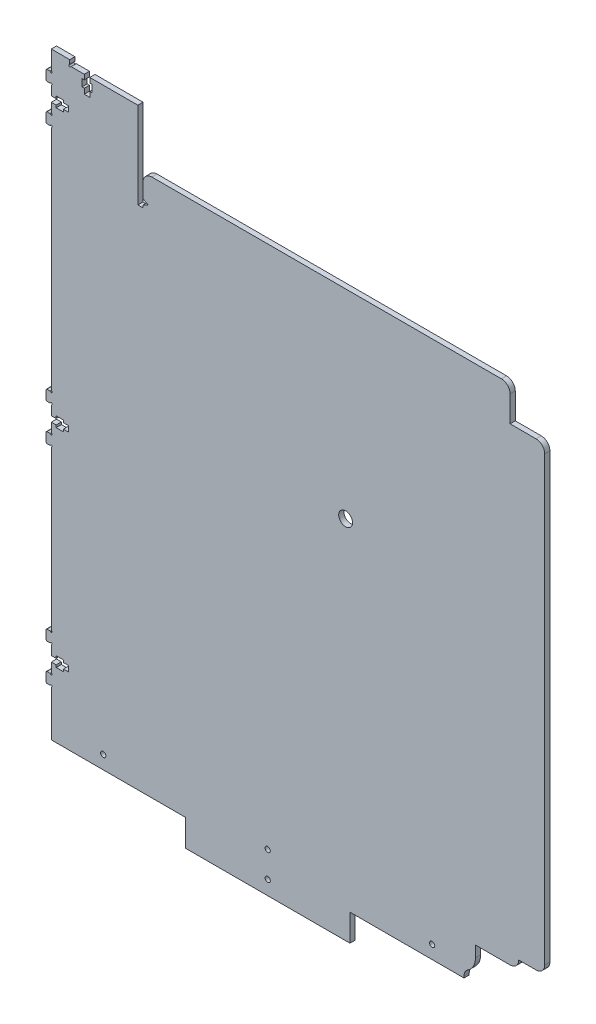
from build123d import *

# Parameters (mm, degrees)
SKETCH2_R           = 1.5
SKETCH2_R_2         = 4
BOSS_EXTRUDE1_DEPTH = 3


with BuildPart() as part:
    # Sketch2 → Boss-Extrude1 (new body)
    with BuildSketch(Plane.XY):
        with BuildLine():
            Line((66.614036598, 872.123994363), (69.614036598, 872.123994363))
            Line((69.614036598, 872.123994363), (69.614036598, 873.621424207))
            Line((69.614036598, 873.621424207), (72.614036598, 875.121424207))
            Line((72.614036598, 875.121424207), (69.614036598, 876.621424207))
            Line((69.614036598, 876.621424207), (69.614036598, 885.121424207))
            ThreePointArc((69.614036598, 885.121424207), (71.078502692, 888.656958113), (74.614036598, 890.121424207))
            Line((74.614036598, 890.121424207), (276.614019697, 890.121424207))
            ThreePointArc((276.614019697, 890.121424207), (280.149553603, 888.656958113), (281.614019697, 885.121424207))
            Line((281.614019697, 885.121424207), (281.614019697, 870.121424207))
            Line((281.614019697, 870.121424207), (296.614019697, 870.121424207))
            ThreePointArc((296.614019697, 870.121424207), (300.149553603, 868.656958113), (301.614019697, 865.121424207))
            Line((301.614019697, 865.121424207), (301.614019697, 609.404970767))
            ThreePointArc((301.614019697, 609.404970767), (300.149553603, 605.869436861), (296.614019697, 604.404970767))
            Line((296.614019697, 604.404970767), (286.614019697, 604.404970767))
            ThreePointArc((286.614019697, 604.404970767), (285.149552896, 600.869436154), (281.614017697, 599.404970767))
            Line((281.614017697, 599.404970767), (261.614042892, 599.404970767))
            Line((261.614042892, 599.404970767), (261.614042892, 592.974211553))
            ThreePointArc((261.614042892, 592.974211553), (260.444450813, 588.281249166), (257.2092637, 584.686057107))
            ThreePointArc((257.2092637, 584.686057107), (255.591670144, 582.888461078), (255.006874104, 580.541979885))
            Line((255.006874104, 580.541979885), (255.006874104, 579.5927571))
            Line((255.006874104, 579.5927571), (189.114038733, 579.5927571))
            Line((189.114038733, 579.5927571), (189.114038733, 564.052971699))
            Line((189.114038733, 564.052971699), (94.114038733, 564.052971699))
            Line((94.114038733, 564.052971699), (94.114038733, 579.501940033))
            Line((94.114038733, 579.501940033), (16.862329805, 579.501940033))
            Line((16.862329805, 579.501940033), (16.862329805, 606.033360561))
            ThreePointArc((16.862329805, 606.033360561), (16.863187514, 606.033859173), (16.864046211, 606.034356083))
            ThreePointArc((16.864046211, 606.034356083), (16.967596169, 606.820921597), (16.181031176, 606.717367681))
            ThreePointArc((16.181031176, 606.717367681), (15.998018539, 606.534354915), (15.748018562, 606.467367529))
            Line((15.748018562, 606.467367529), (14.113992562, 606.467367529))
            ThreePointArc((14.113992562, 606.467367529), (13.760439441, 606.613814787), (13.61399348, 606.967368447))
            Line((13.61399348, 606.967368447), (13.61399348, 611.967366447))
            ThreePointArc((13.61399348, 611.967366447), (13.76044009, 612.320919837), (14.11399348, 612.467366447))
            Line((14.11399348, 612.467366447), (15.74802148, 612.467366447))
            ThreePointArc((15.74802148, 612.467366447), (15.998020915, 612.400379665), (16.181033642, 612.21736795))
            ThreePointArc((16.181033642, 612.21736795), (16.967599727, 612.113815957), (16.86404548, 612.900381745))
            ThreePointArc((16.86404548, 612.900381745), (16.681032778, 613.083394447), (16.61404548, 613.333394447))
            Line((16.61404548, 613.333394447), (16.61404548, 618.467393947))
            Line((16.61404548, 618.467393947), (19.41404548, 618.467393947))
            Line((19.41404548, 618.467393947), (19.41404548, 617.117393947))
            Line((19.41404548, 617.117393947), (23.61404548, 617.117393947))
            Line((23.61404548, 617.117393947), (23.61404548, 618.467393947))
            Line((23.61404548, 618.467393947), (26.61404548, 618.467393947))
            Line((26.61404548, 618.467393947), (26.61404548, 621.667393947))
            Line((26.61404548, 621.667393947), (23.61404548, 621.667393947))
            Line((23.61404548, 621.667393947), (23.61404548, 623.017393947))
            Line((23.61404548, 623.017393947), (19.41404548, 623.017393947))
            Line((19.41404548, 623.017393947), (19.41404548, 621.667393947))
            Line((19.41404548, 621.667393947), (16.61404548, 621.667393947))
            Line((16.61404548, 621.667393947), (16.61404548, 626.801364447))
            ThreePointArc((16.61404548, 626.801364447), (16.681032116, 627.05136392), (16.864043724, 627.234376755))
            ThreePointArc((16.864043724, 627.234376755), (16.967593499, 628.020942293), (16.18102853, 627.917388194))
            ThreePointArc((16.18102853, 627.917388194), (15.998015935, 627.734375385), (15.748015974, 627.667387941))
            Line((15.748015974, 627.667387941), (14.113989974, 627.667387941))
            ThreePointArc((14.113989974, 627.667387941), (13.760436853, 627.813835199), (13.613990892, 628.167388859))
            Line((13.613990892, 628.167388859), (13.613990892, 633.167385859))
            ThreePointArc((13.613990892, 633.167385859), (13.760437502, 633.520939249), (14.113990892, 633.667385859))
            Line((14.113990892, 633.667385859), (15.748018892, 633.667385859))
            ThreePointArc((15.748018892, 633.667385859), (15.998018327, 633.600399077), (16.181031054, 633.417387362))
            ThreePointArc((16.181031054, 633.417387362), (16.967597139, 633.313835369), (16.864042892, 634.100401157))
            ThreePointArc((16.864042892, 634.100401157), (16.68103019, 634.283413859), (16.614042892, 634.533413859))
            Line((16.614042892, 634.533413859), (16.614042892, 725.601355859))
            ThreePointArc((16.614042892, 725.601355859), (16.681029916, 725.851354728), (16.864041374, 726.034367029))
            ThreePointArc((16.864041374, 726.034367029), (16.967591583, 726.82093251), (16.181026557, 726.717378844))
            ThreePointArc((16.181026557, 726.717378844), (15.998013862, 726.534366137), (15.748013864, 726.46737883))
            Line((15.748013864, 726.46737883), (14.113987864, 726.46737883))
            ThreePointArc((14.113987864, 726.46737883), (13.760434473, 726.61382544), (13.613987864, 726.96737883))
            Line((13.613987864, 726.96737883), (13.613987864, 731.96737683))
            ThreePointArc((13.613987864, 731.96737683), (13.760435122, 732.320929952), (14.113988782, 732.467375912))
            Line((14.113988782, 732.467375912), (15.748016782, 732.467375912))
            ThreePointArc((15.748016782, 732.467375912), (15.998016216, 732.40038913), (16.181028944, 732.217377416))
            ThreePointArc((16.181028944, 732.217377416), (16.967595028, 732.113825422), (16.864040782, 732.90039121))
            ThreePointArc((16.864040782, 732.90039121), (16.681026705, 733.083406294), (16.614040782, 733.333409412))
            Line((16.614040782, 733.333409412), (16.614040782, 738.467403412))
            Line((16.614040782, 738.467403412), (19.414040782, 738.467403412))
            Line((19.414040782, 738.467403412), (19.414040782, 737.117403412))
            Line((19.414040782, 737.117403412), (23.614040782, 737.117403412))
            Line((23.614040782, 737.117403412), (23.614040782, 738.467403412))
            Line((23.614040782, 738.467403412), (26.614040782, 738.467403412))
            Line((26.614040782, 738.467403412), (26.614040782, 741.667403412))
            Line((26.614040782, 741.667403412), (23.614040782, 741.667403412))
            Line((23.614040782, 741.667403412), (23.614040782, 743.017403412))
            Line((23.614040782, 743.017403412), (19.414040782, 743.017403412))
            Line((19.414040782, 743.017403412), (19.414040782, 741.667403412))
            Line((19.414040782, 741.667403412), (16.614040782, 741.667403412))
            Line((16.614040782, 741.667403412), (16.614040782, 746.801368412))
            ThreePointArc((16.614040782, 746.801368412), (16.681027814, 747.05136728), (16.864039278, 747.234379574))
            ThreePointArc((16.864039278, 747.234379574), (16.967589513, 748.020945052), (16.181024484, 747.917391412))
            ThreePointArc((16.181024484, 747.917391412), (15.998011782, 747.73437871), (15.748011782, 747.667391412))
            Line((15.748011782, 747.667391412), (14.113985782, 747.667391412))
            ThreePointArc((14.113985782, 747.667391412), (13.760432391, 747.813838022), (13.613985782, 748.167391412))
            Line((13.613985782, 748.167391412), (13.613985782, 753.167389412))
            ThreePointArc((13.613985782, 753.167389412), (13.76043304, 753.520942534), (14.1139867, 753.667388494))
            Line((14.1139867, 753.667388494), (15.7480147, 753.667388494))
            ThreePointArc((15.7480147, 753.667388494), (15.998014134, 753.600401712), (16.181026862, 753.417389998))
            ThreePointArc((16.181026862, 753.417389998), (16.967592946, 753.313838004), (16.8640387, 754.100403792))
            ThreePointArc((16.8640387, 754.100403792), (16.681025998, 754.283416494), (16.6140387, 754.533416494))
            Line((16.6140387, 754.533416494), (16.6140387, 885.601350494))
            ThreePointArc((16.6140387, 885.601350494), (16.681025476, 885.85134993), (16.864037186, 886.034362662))
            ThreePointArc((16.864037186, 886.034362662), (16.967587403, 886.820928142), (16.181022376, 886.717374484))
            ThreePointArc((16.181022376, 886.717374484), (15.998009678, 886.534361778), (15.74800968, 886.467374474))
            Line((15.74800968, 886.467374474), (14.11398368, 886.467374474))
            ThreePointArc((14.11398368, 886.467374474), (13.760430558, 886.613821733), (13.613984598, 886.967375392))
            Line((13.613984598, 886.967375392), (13.613984598, 891.967372392))
            ThreePointArc((13.613984598, 891.967372392), (13.760431207, 892.320925783), (14.113984598, 892.467372392))
            Line((14.113984598, 892.467372392), (15.748012598, 892.467372392))
            ThreePointArc((15.748012598, 892.467372392), (15.998012032, 892.40038561), (16.18102476, 892.217373896))
            ThreePointArc((16.18102476, 892.217373896), (16.967590845, 892.113821902), (16.864036598, 892.90038769))
            ThreePointArc((16.864036598, 892.90038769), (16.681023896, 893.083400392), (16.614036598, 893.333400392))
            Line((16.614036598, 893.333400392), (16.614036598, 898.467399892))
            Line((16.614036598, 898.467399892), (19.414036598, 898.467399892))
            Line((19.414036598, 898.467399892), (19.414036598, 897.117399892))
            Line((19.414036598, 897.117399892), (23.614036598, 897.117399892))
            Line((23.614036598, 897.117399892), (23.614036598, 898.467399892))
            Line((23.614036598, 898.467399892), (26.614036598, 898.467399892))
            Line((26.614036598, 898.467399892), (26.614036598, 901.667399892))
            Line((26.614036598, 901.667399892), (23.614036598, 901.667399892))
            Line((23.614036598, 901.667399892), (23.614036598, 903.017399892))
            Line((23.614036598, 903.017399892), (19.414036598, 903.017399892))
            Line((19.414036598, 903.017399892), (19.414036598, 901.667399892))
            Line((19.414036598, 901.667399892), (16.614036598, 901.667399892))
            Line((16.614036598, 901.667399892), (16.614036598, 906.801370392))
            ThreePointArc((16.614036598, 906.801370392), (16.681023234, 907.051369866), (16.864034841, 907.2343827))
            ThreePointArc((16.864034841, 907.2343827), (16.967584616, 908.020948238), (16.181019648, 907.917394139))
            ThreePointArc((16.181019648, 907.917394139), (15.998007053, 907.73438133), (15.748007092, 907.667393886))
            Line((15.748007092, 907.667393886), (14.113981092, 907.667393886))
            ThreePointArc((14.113981092, 907.667393886), (13.76042797, 907.813841145), (13.61398201, 908.167394804))
            Line((13.61398201, 908.167394804), (13.61398201, 913.167391804))
            ThreePointArc((13.61398201, 913.167391804), (13.760428619, 913.520945195), (14.11398201, 913.667391804))
            Line((14.11398201, 913.667391804), (15.74801001, 913.667391804))
            ThreePointArc((15.74801001, 913.667391804), (15.998009444, 913.600405022), (16.181022172, 913.417393308))
            ThreePointArc((16.181022172, 913.417393308), (16.967587649, 913.313843073), (16.86403401, 914.100408102))
            ThreePointArc((16.86403401, 914.100408102), (16.681021308, 914.283420804), (16.61403401, 914.533420804))
            Line((16.61403401, 914.533420804), (16.61403401, 925.121424207))
            Line((16.61403401, 925.121424207), (27.264027052, 925.121424207))
            Line((27.264027052, 925.121424207), (27.264027052, 922.887380552))
            ThreePointArc((27.264027052, 922.887380552), (27.197039554, 922.637380808), (27.01402688, 922.454368354))
            ThreePointArc((27.01402688, 922.454368354), (26.91047314, 921.667803115), (27.69703877, 921.771353876))
            ThreePointArc((27.69703877, 921.771353876), (27.880051343, 921.954365391), (28.130050509, 922.021352207))
            Line((28.130050509, 922.021352207), (35.664027208, 922.021352207))
            Line((35.664027208, 922.021352207), (35.664027208, 919.221352207))
            Line((35.664027208, 919.221352207), (34.314027208, 919.221352207))
            Line((34.314027208, 919.221352207), (34.314027208, 915.021352207))
            Line((34.314027208, 915.021352207), (35.664027208, 915.021352207))
            Line((35.664027208, 915.021352207), (35.664027208, 912.021352207))
            Line((35.664027208, 912.021352207), (38.864027208, 912.021352207))
            Line((38.864027208, 912.021352207), (38.864027208, 915.021352207))
            Line((38.864027208, 915.021352207), (40.214027208, 915.021352207))
            Line((40.214027208, 915.021352207), (40.214027208, 919.221352207))
            Line((40.214027208, 919.221352207), (38.864027208, 919.221352207))
            Line((38.864027208, 919.221352207), (38.864027208, 922.021352207))
            Line((38.864027208, 922.021352207), (66.614036598, 922.021352207))
            Line((66.614036598, 922.021352207), (66.614036598, 872.123994363))
        make_face()
        with Locations((236.614038733, 587.22051341)):
            Circle(SKETCH2_R, mode=Mode.SUBTRACT)
        with Locations((46.614038733, 587.22051341)):
            Circle(SKETCH2_R, mode=Mode.SUBTRACT)
        with Locations((141.614038733, 572.234366656)):
            Circle(SKETCH2_R, mode=Mode.SUBTRACT)
        with Locations((141.614038733, 587.22051341)):
            Circle(SKETCH2_R, mode=Mode.SUBTRACT)
        with Locations((186.614019697, 775.121424207)):
            Circle(SKETCH2_R_2, mode=Mode.SUBTRACT)
    extrude(amount=BOSS_EXTRUDE1_DEPTH)


solid = part.part
